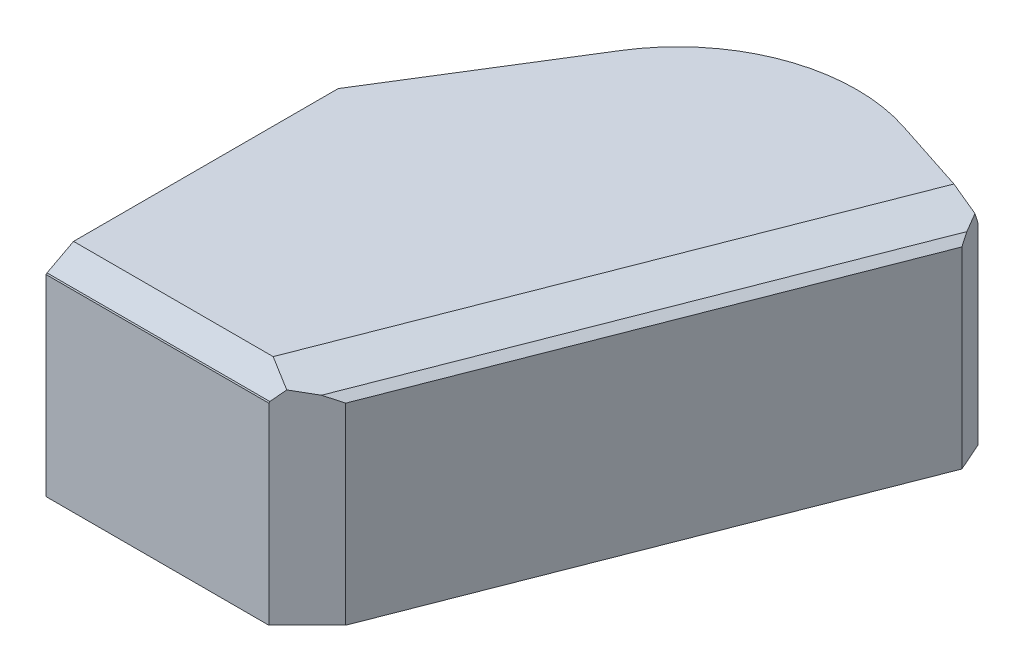
from build123d import *
from OCP.BRepFilletAPI import BRepFilletAPI_MakeChamfer

# Parameters (mm, degrees)
BOSS_EXTRUDE1_DEPTH = 58.42
CHAMFER1_SIZE       = 6.35
CHAMFER1_SIZE2      = 6.020287439
CHAMFER1_SIZE2_2    = 11.16699707
CHAMFER2_SIZE       = 6.35
CHAMFER2_SIZE2      = 2.311210988
CHAMFER3_SIZE       = 6.35
CHAMFER3_SIZE_2     = 5.138982639
CHAMFER3_SIZE_3     = 2.835119985
CHAMFER3_SIZE_4     = 2.311210988


with BuildPart() as part:
    # Sketch1 → Boss-Extrude1 (new body)
    with BuildSketch(Plane(origin=(0, 0, 0), x_dir=(1, 0, 0), z_dir=(0, 1, 0))):
        with BuildLine():
            Line((-66.673768512, 0), (-37.067821873, 47.633329988))
            ThreePointArc((-37.067821873, 47.633329988), (-11.329209284, 68.541566023), (21.82652777, 69.113940477))
            Line((21.82652777, 69.113940477), (53.138492197, 58.903517294))
            Line((53.138492197, 58.903517294), (0, -77.45185891))
            Line((0, -77.45185891), (-66.673768512, -77.45185891))
            Line((-66.673768512, -77.45185891), (-66.673768512, 0))
        make_face()
    extrude(amount=BOSS_EXTRUDE1_DEPTH)

    # Chamfer1: one chamfer whose edges measure the first distance from different faces: ONE call of the kernel's chamfer builder (chamfer() names one face for all edges)
    chamfer1_edges_1 = [part.edges().sort_by_distance(p)[0] for p in [
        (26.569246099, 58.42, 9.274170808),
    ]]
    chamfer1_edges_2 = [part.edges().sort_by_distance(p)[0] for p in [
        (53.138492197, 29.21, -58.903517294),
    ]]
    chamfer1_side_2 = [part.faces().sort_by_distance(p)[0] for p in [
        (26.569246099, 29.21, 9.274170808),
    ]]
    chamfer1_edges_3 = [part.edges().sort_by_distance(p)[0] for p in [
        (0, 29.21, 77.45185891),
    ]]
    chamfer1_side_3 = [part.faces().sort_by_distance(p)[0] for p in [
        (-33.336884256, 29.21, 77.45185891),
    ]]
    chamfer1 = BRepFilletAPI_MakeChamfer(part.part.solid().wrapped)
    for e in chamfer1_edges_1:
        chamfer1.Add(CHAMFER1_SIZE, e.wrapped)
    for e in chamfer1_edges_2:
        chamfer1.Add(CHAMFER1_SIZE, CHAMFER1_SIZE2, e.wrapped, chamfer1_side_2[0].wrapped)  # the first distance lies on this face
    for e in chamfer1_edges_3:
        chamfer1.Add(CHAMFER1_SIZE, CHAMFER1_SIZE2_2, e.wrapped, chamfer1_side_3[0].wrapped)  # the first distance lies on this face
    add(Compound.cast(chamfer1.Shape()), mode=Mode.REPLACE)

    # Chamfer2
    chamfer2_edges = [part.edges().sort_by_distance(p)[0] for p in [
        (-36.744460568, 58.42, 77.45185891),
    ]]
    chamfer2_side = [part.faces().sort_by_distance(p)[0] for p in [
        (-36.512742561, 29.20916862, 77.45185891),
    ]]
    chamfer(chamfer2_edges, length=CHAMFER2_SIZE, length2=CHAMFER2_SIZE2, reference=chamfer2_side[0])

    # Chamfer3
    # the kernel refuses this chamfer: 6.35, 5.138982639, 2.835119985, 2.311210988 mm, written as the material it takes off along each edge
    with BuildSketch(Plane(origin=(53.073265581, 58.42, -76.224082144), x_dir=(0.6674738144333207, -0.6977227871251095, 0.2601184718012205), z_dir=(-0.3631074004698769, 0, 0.9317472917717596))) as chamfer3_piece_1:
        Polygon((CHAMFER3_SIZE * 0.999913086528, -CHAMFER3_SIZE * 0.0131840581986), (-CHAMFER3_SIZE_2 * 0.716367861072, -CHAMFER3_SIZE_2 * 0.69772278716), (0, 0), align=None)
    extrude(amount=178.925693595, mode=Mode.SUBTRACT)
    with BuildSketch(Plane(origin=(10.558676445, 58.42, 75.140647923), x_dir=(0, -0.9351017353626564, 0.3543793793687052), z_dir=(-1, 0, 0))) as chamfer3_piece_2:
        Polygon((CHAMFER3_SIZE * 0.999913086528, -CHAMFER3_SIZE * 0.0131840581986), (-CHAMFER3_SIZE_3 * 0.354379379374, -CHAMFER3_SIZE_3 * 0.935101735377), (0, 0), align=None)
    extrude(amount=93.705581509, mode=Mode.SUBTRACT)
    with BuildSketch(Plane(origin=(21.82652777, 58.42, -69.113940477), x_dir=(-0.3084963411353717, 0.09904090225204967, 0.946055446148474), z_dir=(0.9507298394814789, 0, 0.3100205998309168))) as chamfer3_piece_3:
        Polygon((CHAMFER3_SIZE_4 * 0.995083363005, CHAMFER3_SIZE_4 * 0.0990409022345), (-CHAMFER3_SIZE * 0.099040902252, CHAMFER3_SIZE * 0.995083363182), (0, 0), align=None)
    extrude(amount=43.047689039, mode=Mode.SUBTRACT)
    with BuildSketch(Plane(origin=(6.077481299, 58.42, -20.816864631), x_dir=(-0.849316991574707, 0, -0.5278831763018113), z_dir=(-0.5278831763018113, 0, 0.849316991574707))) as chamfer3_piece_4:
        Polygon((50.8 - CHAMFER3_SIZE_4, 0), (50.8, CHAMFER3_SIZE), (50.8, 0), align=None)
    revolve(axis=Axis((6.077481299, 58.42, -20.816864631), (0, -1, 0)), revolution_arc=76.197931096, mode=Mode.SUBTRACT)
    with BuildSketch(Plane(origin=(-75.369660158, 58.42, 13.990914778), x_dir=(0.8451412083835613, 0.0990409022520497, 0.5252877664414751), z_dir=(0.5278831763018161, 0, -0.849316991574704))) as chamfer3_piece_5:
        Polygon((CHAMFER3_SIZE_4 * 0.995083363005, CHAMFER3_SIZE_4 * 0.0990409022345), (-CHAMFER3_SIZE * 0.0990409022521, CHAMFER3_SIZE * 0.995083363182), (0, 0), align=None)
    extrude(amount=72.557414224, mode=Mode.SUBTRACT)
    with BuildSketch(Plane(origin=(-66.673768512, 58.42, 91.613784474), x_dir=(0.9950833631817486, 0.09904090225205003, 0), z_dir=(0, 0, -1))) as chamfer3_piece_6:
        Polygon((CHAMFER3_SIZE_4 * 0.995083363005, CHAMFER3_SIZE_4 * 0.0990409022345), (-CHAMFER3_SIZE * 0.0990409022521, CHAMFER3_SIZE * 0.995083363182), (0, 0), align=None)
    extrude(amount=108.086921026, mode=Mode.SUBTRACT)


solid = part.part
